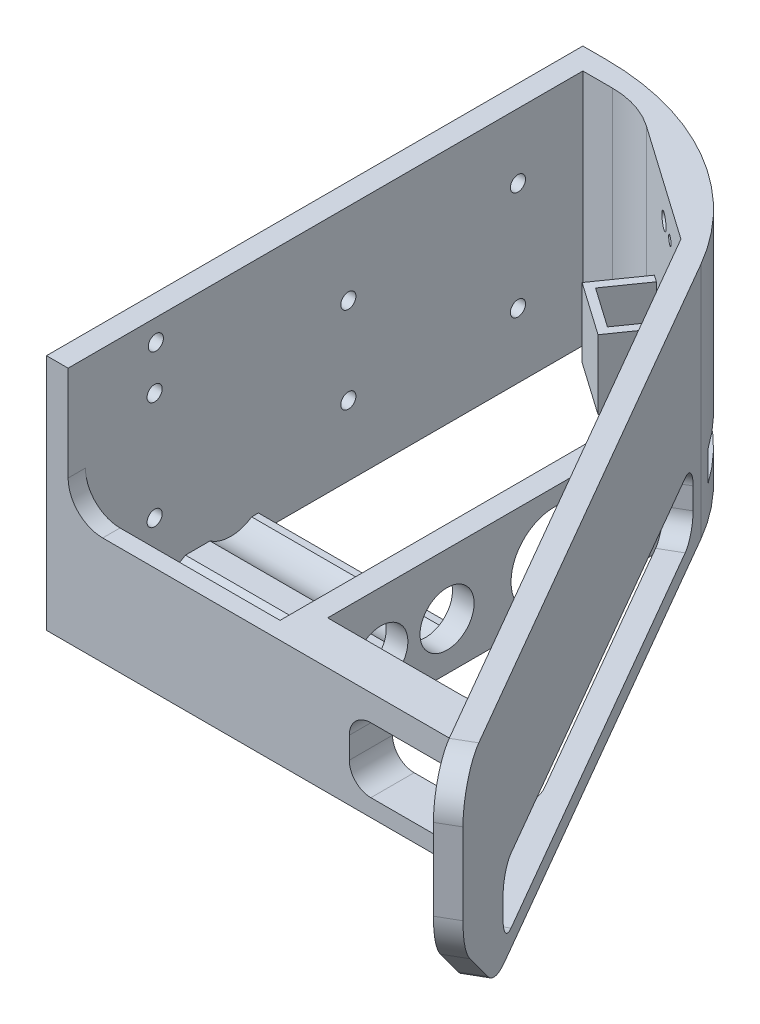
from build123d import *

# Parameters (mm, degrees)
BOSS_EXTRUDE3_DEPTH     = 55
FILLET1_R               = 60
SKETCH4_W               = 15
SKETCH4_H               = 16
BOSS_EXTRUDE4_DEPTH     = 12
CUT_EXTRUDE1_DEPTH      = 20
CUT_EXTRUDE1_DEPTH_BACK = 14
SKETCH5_W               = 40
SKETCH5_H               = 7
CUT_EXTRUDE2_DEPTH      = 14
SKETCH7_R               = 2
CUT_EXTRUDE3_DEPTH      = 2
CUT_EXTRUDE4_DEPTH      = 30
SKETCH9_R               = 10
SKETCH9_R_2             = 6.25
CUT_EXTRUDE5_DEPTH      = 5
SKETCH10_W              = 120
SKETCH10_H              = 15
CUT_EXTRUDE6_DEPTH      = 5
SKETCH11_W              = 4
SKETCH11_H              = 25
BOSS_EXTRUDE5_DEPTH     = 45
FILLET3_R               = 20
BOSS_EXTRUDE6_REACH     = 190.434
SKETCH12_W              = 10
SKETCH12_H              = 4
SKETCH13_W              = 40
SKETCH13_H              = 4
BOSS_EXTRUDE7_DEPTH     = 45
FILLET4_R               = 5
CUT_EXTRUDE7_DEPTH      = 45
SKETCH16_R              = 1.75
CUT_EXTRUDE8_DEPTH      = 5
SKETCH15_R              = 1.75
CUT_EXTRUDE9_DEPTH      = 5
CUT_EXTRUDE10_REACH     = 216.345
SKETCH17_R              = 1.75
SKETCH17_R_2            = 1
CHAMFER1_SIZE           = 20
FILLET6_R               = 15
FILLET7_R               = 10
SKETCH18_W              = 15
SKETCH18_H              = 10
BOSS_EXTRUDE8_DEPTH     = 21
SKETCH19_W              = 10
SKETCH19_H              = 6
BOSS_EXTRUDE9_DEPTH     = 35.817931
FILLET9_R               = 5
FILLET10_R              = 8
FILLET11_R              = 8


with BuildPart() as part:
    # Sketch3 → Boss-Extrude3 (new body)
    with BuildSketch(Plane(origin=(0, 0, 0), x_dir=(1, 0, 0), z_dir=(0, 1, 0))):
        Polygon((128.169872981, -162.7146997), (55, -35.980762114), (55, -124), (50, -124), (50, -27.320508076), (18.123010882, -5), (5, -5), (5, -124), (0, -124), (0, 0), (40, 0), (132.5, -160.2146997), align=None)
    extrude(amount=BOSS_EXTRUDE3_DEPTH)

    # Fillet1
    fillet1_edges = [part.edges().sort_by_distance(p)[0] for p in [
        (40, 27.5, 0),
    ]]
    fillet(fillet1_edges, radius=FILLET1_R)

    # Sketch4 → Boss-Extrude4 (add)
    with BuildSketch(Plane(origin=(3.613056499, 0, -5.159979438), x_dir=(0.8191520442889911, 0, 0.5735764363510469), z_dir=(-0.5735764363510469, 0, 0.8191520442889911))):
        with Locations((39.128001876, 22.366188336)):
            Rectangle(SKETCH4_W, SKETCH4_H)
    extrude(amount=BOSS_EXTRUDE4_DEPTH)

    # Sketch5 → Cut-Extrude1 (cut, two sides: drawn at the far end of the back side and taken through both)
    with BuildSketch(Plane(origin=(3.613056499, 0, -5.159979438), x_dir=(0.8191520442889911, 0, 0.5735764363510469), z_dir=(-0.5735764363510469, 0, 0.8191520442889911)).offset(-CUT_EXTRUDE1_DEPTH_BACK)):
        with Locations((39.128001876, 10.866188336)):
            Rectangle(SKETCH5_W, SKETCH5_H)
    extrude(amount=CUT_EXTRUDE1_DEPTH + CUT_EXTRUDE1_DEPTH_BACK, mode=Mode.SUBTRACT)

    # Sketch6 → Cut-Extrude2 (cut)
    with BuildSketch(Plane(origin=(0, 30.366188336, 0), x_dir=(1, 0, 0), z_dir=(0, 1, 0))):
        Polygon((31.077587777, -14.070892396), (25.28446577, -22.344328043), (34.458968666, -28.76838413), (40.252090673, -20.494948483), align=None)
    extrude(amount=-CUT_EXTRUDE2_DEPTH, mode=Mode.SUBTRACT)

    # Sketch7 → Cut-Extrude3 (cut)
    with BuildSketch(Plane(origin=(0, 16.366188336, 0), x_dir=(1, 0, 0), z_dir=(0, 1, 0))):
        with Locations(Location((32.768278221, -21.419638263, 0), (0, 0, 270))):
            Circle(SKETCH7_R)
    extrude(amount=-CUT_EXTRUDE3_DEPTH, mode=Mode.SUBTRACT)

    # Sketch8 → Cut-Extrude4 (cut)
    with BuildSketch(Plane(origin=(0, 55, 0), x_dir=(1, 0, 0), z_dir=(0, 1, 0))):
        Polygon((55, -35.980762114), (50, -27.320508076), (50, -124), (55, -124), align=None)
    extrude(amount=-CUT_EXTRUDE4_DEPTH, mode=Mode.SUBTRACT)

    # Sketch9 → Cut-Extrude5 (cut)
    with BuildSketch(Plane.ZY.offset(-50)):
        with Locations((61.598678321, 11)):
            Circle(SKETCH9_R)
        with Locations((86.385123427, 11)):
            Circle(SKETCH9_R_2)
        with Locations((101.700022006, 11)):
            Circle(SKETCH9_R_2)
    extrude(amount=-CUT_EXTRUDE5_DEPTH, mode=Mode.SUBTRACT)

    # Sketch10 → Cut-Extrude6 (cut)
    with BuildSketch(Plane(origin=(30, 0, -17.320508076), x_dir=(-0.5000000000000047, 0, -0.866025403784436), z_dir=(0.866025403784436, 0, -0.5000000000000047))):
        with Locations((-119.641016151, 11.5)):
            Rectangle(SKETCH10_W, SKETCH10_H)
    extrude(amount=-CUT_EXTRUDE6_DEPTH, mode=Mode.SUBTRACT)

    # Sketch11 → Boss-Extrude5 (add)
    with BuildSketch(Plane.ZY.offset(-50)):
        with Locations((122, 12.5)):
            Rectangle(SKETCH11_W, SKETCH11_H)
    extrude(amount=BOSS_EXTRUDE5_DEPTH)

    # Fillet3
    # the kernel refuses this fillet: 20 mm, written as the material it adds along each edge
    with BuildSketch(Plane(origin=(18.123010882, 0, 5), x_dir=(-1, 0, 0), z_dir=(0, 1, 0))) as fillet3_piece_1_section:
        with BuildLine():
            CenterArc((FILLET3_R * 0.315298788879, FILLET3_R), FILLET3_R, 235, 35)
            Line((-FILLET3_R * 0.258277647472, FILLET3_R * 0.180847955711), (0, 0))
            Line((0, 0), (FILLET3_R * 0.315298788879, 0))
        make_face()
    fillet3_piece_1 = extrude(amount=55, mode=Mode.PRIVATE)
    fillet3_piece_1 = split(fillet3_piece_1, bisect_by=Plane(origin=(18.647698148, 3.683094168, 6.716980636), z_dir=(-0.8191520442889912, 0, -0.5735764363510469)), keep=Keep.TOP, mode=Mode.PRIVATE)
    fillet3_piece_1 = split(fillet3_piece_1, bisect_by=Plane(origin=(16.403340896, 7.366188336, 5.14546477), z_dir=(0, -1, 0)), keep=Keep.TOP, mode=Mode.PRIVATE)
    add(fillet3_piece_1)
    with BuildSketch(Plane(origin=(18.123010882, 0, 5), x_dir=(-1, 0, 0), z_dir=(0, 1, 0))) as fillet3_piece_2_section:
        with BuildLine():
            CenterArc((FILLET3_R * 0.315298788879, FILLET3_R), FILLET3_R, 235, 35)
            Line((-FILLET3_R * 0.258277647472, FILLET3_R * 0.180847955711), (0, 0))
            Line((0, 0), (FILLET3_R * 0.315298788879, 0))
        make_face()
    fillet3_piece_2 = extrude(amount=55, mode=Mode.PRIVATE)
    fillet3_piece_2 = split(fillet3_piece_2, bisect_by=Plane(origin=(19.32323837, 3.683094168, 5.752209215), z_dir=(0.8191520442889912, 0, 0.5735764363510469)), keep=Keep.TOP, mode=Mode.PRIVATE)
    fillet3_piece_2 = split(fillet3_piece_2, bisect_by=Plane(origin=(20.990357579, 7.366188336, 6.919538653), z_dir=(0, -1, 0)), keep=Keep.TOP, mode=Mode.PRIVATE)
    add(fillet3_piece_2)
    with BuildSketch(Plane(origin=(18.123010882, 0, 5), x_dir=(-1, 0, 0), z_dir=(0, 1, 0))) as fillet3_piece_3_section:
        with BuildLine():
            CenterArc((FILLET3_R * 0.315298788879, FILLET3_R), FILLET3_R, 235, 35)
            Line((-FILLET3_R * 0.258277647472, FILLET3_R * 0.180847955711), (0, 0))
            Line((0, 0), (FILLET3_R * 0.315298788879, 0))
        make_face()
    fillet3_piece_3 = extrude(amount=55, mode=Mode.PRIVATE)
    fillet3_piece_3 = split(fillet3_piece_3, bisect_by=Plane(origin=(16.403340896, 14.366188336, 5.14546477), z_dir=(0, -1, 0)), keep=Keep.TOP, mode=Mode.PRIVATE)
    fillet3_piece_3 = split(fillet3_piece_3, bisect_by=Plane(origin=(18.647698148, 10.866188336, 6.716980636), z_dir=(-0.8191520442889912, 0, -0.5735764363510469)), keep=Keep.TOP, mode=Mode.PRIVATE)
    fillet3_piece_3 = split(fillet3_piece_3, bisect_by=Plane(origin=(16.403340896, 7.366188336, 5.14546477), z_dir=(0, 1, 0)), keep=Keep.TOP, mode=Mode.PRIVATE)
    add(fillet3_piece_3)
    with BuildSketch(Plane(origin=(18.123010882, 0, 5), x_dir=(-1, 0, 0), z_dir=(0, 1, 0))) as fillet3_piece_4_section:
        with BuildLine():
            CenterArc((FILLET3_R * 0.315298788879, FILLET3_R), FILLET3_R, 235, 35)
            Line((-FILLET3_R * 0.258277647472, FILLET3_R * 0.180847955711), (0, 0))
            Line((0, 0), (FILLET3_R * 0.315298788879, 0))
        make_face()
    fillet3_piece_4 = extrude(amount=55, mode=Mode.PRIVATE)
    fillet3_piece_4 = split(fillet3_piece_4, bisect_by=Plane(origin=(16.403340896, 14.366188336, 5.14546477), z_dir=(0, 1, 0)), keep=Keep.TOP, mode=Mode.PRIVATE)
    fillet3_piece_4 = split(fillet3_piece_4, bisect_by=Plane(origin=(18.647698148, 34.683094168, 6.716980636), z_dir=(-0.8191520442889912, 0, -0.5735764363510469)), keep=Keep.TOP, mode=Mode.PRIVATE)
    add(fillet3_piece_4)
    with BuildSketch(Plane(origin=(18.123010882, 0, 5), x_dir=(-1, 0, 0), z_dir=(0, 1, 0))) as fillet3_piece_5_section:
        with BuildLine():
            CenterArc((FILLET3_R * 0.315298788879, FILLET3_R), FILLET3_R, 235, 35)
            Line((-FILLET3_R * 0.258277647472, FILLET3_R * 0.180847955711), (0, 0))
            Line((0, 0), (FILLET3_R * 0.315298788879, 0))
        make_face()
    fillet3_piece_5 = extrude(amount=55, mode=Mode.PRIVATE)
    fillet3_piece_5 = split(fillet3_piece_5, bisect_by=Plane(origin=(20.990357579, 14.366188336, 6.919538653), z_dir=(0, 1, 0)), keep=Keep.TOP, mode=Mode.PRIVATE)
    fillet3_piece_5 = split(fillet3_piece_5, bisect_by=Plane(origin=(19.32323837, 34.683094168, 5.752209215), z_dir=(0.8191520442889912, 0, 0.5735764363510469)), keep=Keep.TOP, mode=Mode.PRIVATE)
    add(fillet3_piece_5)

    # Boss-Extrude6: up to this plane
    boss_extrude6_end = Plane(origin=(128.169872981, 55, 162.7146997), z_dir=(-0.8660254037844362, 0, 0.5000000000000044))
    # Sketch12 → Boss-Extrude6 (add, up to the surface)
    with BuildSketch(Plane(origin=(55, 0, 0), x_dir=(0, 0, -1), z_dir=(1, 0, 0)), mode=Mode.PRIVATE) as boss_extrude6_sk1:
        with Locations((-119, 2)):
            Rectangle(SKETCH12_W, SKETCH12_H)
    boss_extrude6_tool1 = split(extrude(boss_extrude6_sk1.sketch, amount=BOSS_EXTRUDE6_REACH, mode=Mode.PRIVATE), bisect_by=boss_extrude6_end, keep=Keep.BOTH, mode=Mode.PRIVATE)
    add(boss_extrude6_tool1.solids().sort_by_distance((55, 2, 119))[0])

    # Sketch13 → Boss-Extrude7 (add)
    with BuildSketch(Plane.ZY.offset(-50)):
        with Locations((100, 2)):
            Rectangle(SKETCH13_W, SKETCH13_H)
    extrude(amount=BOSS_EXTRUDE7_DEPTH)

    # Fillet4
    fillet4_edges = [part.edges().sort_by_distance(p)[0] for p in [
        (57.655444566, 4, 35.580127019),
        (57.655444566, 19, 35.580127019),
        (117.655444566, 19, 139.503175473),
        (117.655444566, 4, 139.503175473),
    ]]
    fillet(fillet4_edges, radius=FILLET4_R)

    # Sketch14 → Cut-Extrude7 (cut)
    with BuildSketch(Plane.ZY.offset(-50)):
        with BuildLine():
            ThreePointArc((94.042572717, 14.689643665), (77.885123427, 11), (94.042572717, 7.310356335))
            ThreePointArc((94.042572717, 7.310356335), (110.200022006, 11), (94.042572717, 14.689643665))
        make_face()
    extrude(amount=CUT_EXTRUDE7_DEPTH, mode=Mode.SUBTRACT)

    # Sketch16 → Cut-Extrude8 (cut)
    with BuildSketch(Plane.ZY):
        with Locations((59.208509529, 36.135781847)):
            Circle(SKETCH16_R)
        with Locations((59.208509529, 16.135781847)):
            Circle(SKETCH16_R)
        with Locations((103.718271361, 50.013687011)):
            Circle(SKETCH16_R)
    extrude(amount=-CUT_EXTRUDE8_DEPTH, mode=Mode.SUBTRACT)

    # Sketch15 → Cut-Extrude9 (cut)
    with BuildSketch(Plane.ZY):
        with Locations((104, 40)):
            Circle(SKETCH15_R)
        with Locations((104, 15)):
            Circle(SKETCH15_R)
        with Locations((20, 15)):
            Circle(SKETCH15_R)
        with Locations((20, 40)):
            Circle(SKETCH15_R)
    extrude(amount=-CUT_EXTRUDE9_DEPTH, mode=Mode.SUBTRACT)

    # Cut-Extrude10: up to this plane
    cut_extrude10_end = Plane(origin=(18.123010882, 55, 5), z_dir=(0.5735764363510469, 0, -0.8191520442889914))
    # Sketch17 → Cut-Extrude10 (cut, up to the surface)
    with BuildSketch(Plane(origin=(30, 0, -17.320508076), x_dir=(-0.5000000000000047, 0, -0.866025403784436), z_dir=(0.866025403784436, 0, -0.5000000000000047)), mode=Mode.PRIVATE) as cut_extrude10_sk1:
        with Locations((-34.202339372, 47.5)):
            Circle(SKETCH17_R)
    cut_extrude10_tool1 = split(extrude(cut_extrude10_sk1.sketch, amount=-CUT_EXTRUDE10_REACH, mode=Mode.PRIVATE), bisect_by=cut_extrude10_end, keep=Keep.BOTH, mode=Mode.PRIVATE)
    add(cut_extrude10_tool1.solids().sort_by_distance((47.10117, 47.5, 12.299587))[0], mode=Mode.SUBTRACT)
    # Sketch17 → Cut-Extrude10 (cut, up to the surface)
    with BuildSketch(Plane(origin=(30, 0, -17.320508076), x_dir=(-0.5000000000000047, 0, -0.866025403784436), z_dir=(0.866025403784436, 0, -0.5000000000000047)), mode=Mode.PRIVATE) as cut_extrude10_sk2:
        with Locations((-39.202339372, 47.5)):
            Circle(SKETCH17_R_2)
    cut_extrude10_tool2 = split(extrude(cut_extrude10_sk2.sketch, amount=-CUT_EXTRUDE10_REACH, mode=Mode.PRIVATE), bisect_by=cut_extrude10_end, keep=Keep.BOTH, mode=Mode.PRIVATE)
    add(cut_extrude10_tool2.solids().sort_by_distance((49.60117, 47.5, 16.629714))[0], mode=Mode.SUBTRACT)

    # Chamfer1
    chamfer1_edges = [part.edges().sort_by_distance(p)[0] for p in [
        (130.334936491, 0, 161.4646997),
    ]]
    chamfer(chamfer1_edges, length=CHAMFER1_SIZE)

    # Fillet6
    fillet6_edges = [part.edges().sort_by_distance(p)[0] for p in [
        (120.334936491, 0, 144.144191624),
        (130.334936491, 20, 161.4646997),
    ]]
    fillet(fillet6_edges, radius=FILLET6_R)

    # Fillet7
    fillet7_edges = [part.edges().sort_by_distance(p)[0] for p in [
        (130.334936491, 55, 161.4646997),
    ]]
    fillet(fillet7_edges, radius=FILLET7_R)

    # Sketch18 → Boss-Extrude8 (add)
    with BuildSketch(Plane(origin=(0, 4, 0), x_dir=(1, 0, 0), z_dir=(0, 1, 0))):
        with Locations((62.5, -119)):
            Rectangle(SKETCH18_W, SKETCH18_H)
    extrude(amount=BOSS_EXTRUDE8_DEPTH)

    # Sketch19 → Boss-Extrude9 (add)
    with BuildSketch(Plane(origin=(70, 0, 0), x_dir=(0, 0, -1), z_dir=(1, 0, 0))):
        with Locations((-119, 22)):
            Rectangle(SKETCH19_W, SKETCH19_H)
    extrude(amount=BOSS_EXTRUDE9_DEPTH)

    # Fillet9
    fillet9_edges = [part.edges().sort_by_distance(p)[0] for p in [
        (70, 4, 119),
        (70, 19, 119),
    ]]
    fillet(fillet9_edges, radius=FILLET9_R)

    # Fillet10
    fillet10_edges = [part.edges().sort_by_distance(p)[0] for p in [
        (100.044427996, 2, 114),
        (100.044427996, 22, 114),
    ]]
    fillet(fillet10_edges, radius=FILLET10_R)

    # Fillet11
    fillet11_edges = [part.edges().sort_by_distance(p)[0] for p in [
        (5, 25, 122),
    ]]
    fillet(fillet11_edges, radius=FILLET11_R)


solid = part.part
